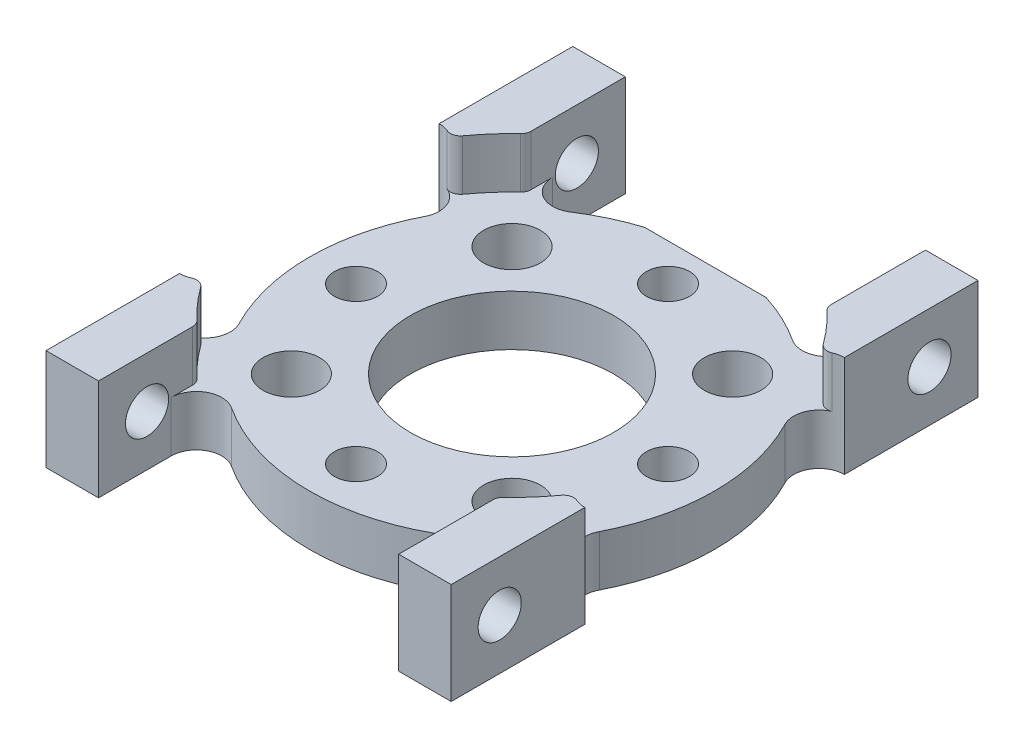
from build123d import *

# Parameters (mm, degrees)
CUT_EXTRUDE1_START         = -6.35
CUT_EXTRUDE1_DEPTH         = 3.175
CUT_EXTRUDE1_START_2       = -3.175
CUT_EXTRUDE1_2_DEPTH       = 3.175
SKETCH2_W                  = 3.293618
SKETCH2_H                  = 6.35
BOSS_EXTRUDE1_DEPTH        = 4.551833731
SKETCH3_W                  = 3.293618
SKETCH3_H                  = 6.35
BOSS_EXTRUDE2_DEPTH        = 4.551833731
SKETCH4_W                  = 3.293618
SKETCH4_H                  = 6.35
BOSS_EXTRUDE3_DEPTH        = 4.551833731
SKETCH5_W                  = 3.293618
SKETCH5_H                  = 6.35
BOSS_EXTRUDE4_DEPTH        = 4.551833731
HOLE1_D                    = 12.7254
M2_5_CLEARANCE_HOLE1_D     = 2.7051
M3_CLEARANCE_HOLE1_D       = 3.556
M2_5_CLEARANCE_HOLE2_D     = 2.7051
M2_5_CLEARANCE_HOLE2_DEPTH = 3.293618
M2_5_CLEARANCE_HOLE3_D     = 2.7051
M2_5_CLEARANCE_HOLE3_DEPTH = 3.293618
M2_5_CLEARANCE_HOLE4_D     = 2.7051
M2_5_CLEARANCE_HOLE4_DEPTH = 25.4
M2_5_CLEARANCE_HOLE5_D     = 2.7051
M2_5_CLEARANCE_HOLE5_DEPTH = 3.293618
FILLET1_R                  = 0.635


with BuildPart() as part:
    # Cut-Extrude1: read off the stored shape, not the designer's step
    # Cut-Extrude1 outline → Cut-Extrude1 (new body)
    with BuildSketch(Plane(origin=(0, 6.35, 0), x_dir=(-1, 0, 0), z_dir=(0, 1, 0)).offset(CUT_EXTRUDE1_START)):
        with BuildLine():
            ThreePointArc((-12.7, 8.135112), (-11.343887812, 7.373541875), (-11.288347253, 5.819210969))
            ThreePointArc((-11.288347253, 5.819210969), (-12.7, 0), (-11.288347253, -5.819210969))
            ThreePointArc((-11.288347253, -5.819210969), (-11.343887812, -7.373541875), (-12.7, -8.135112))
            Line((-12.7, -8.135112), (-12.7, -11.958166269))
            Line((-12.7, -11.958166269), (-9.406382, -11.958166269))
            ThreePointArc((-9.406382, -11.958166269), (-8.574193969, -10.561863981), (-6.950117333, -10.629481128))
            ThreePointArc((-6.950117333, -10.629481128), (0, -12.7), (6.950117333, -10.629481128))
            ThreePointArc((6.950117333, -10.629481128), (8.574193969, -10.561863981), (9.406382, -11.958166269))
            Line((9.406382, -11.958166269), (12.7, -11.958166269))
            Line((12.7, -11.958166269), (12.7, -8.135112))
            ThreePointArc((12.7, -8.135112), (11.343887812, -7.373541875), (11.288347253, -5.819210969))
            ThreePointArc((11.288347253, -5.819210969), (12.7, 0), (11.288347253, 5.819210969))
            ThreePointArc((11.288347253, 5.819210969), (11.343887812, 7.373541875), (12.7, 8.135112))
            Line((12.7, 8.135112), (12.7, 11.958166269))
            Line((12.7, 11.958166269), (9.406382, 11.958166269))
            ThreePointArc((9.406382, 11.958166269), (8.574193969, 10.561863981), (6.950117333, 10.629481128))
            ThreePointArc((6.950117333, 10.629481128), (0, 12.7), (-6.950117333, 10.629481128))
            ThreePointArc((-6.950117333, 10.629481128), (-8.574193969, 10.561863981), (-9.406382, 11.958166269))
            Line((-9.406382, 11.958166269), (-12.7, 11.958166269))
            Line((-12.7, 11.958166269), (-12.7, 8.135112))
        make_face()
    extrude(amount=CUT_EXTRUDE1_DEPTH)

    # Cut-Extrude1 2 outline → Cut-Extrude1 2 (add)
    with BuildSketch(Plane(origin=(0, 6.35, 0), x_dir=(-1, 0, 0), z_dir=(0, 1, 0)).offset(CUT_EXTRUDE1_START_2)):
        with BuildLine():
            Line((-9.406382, 10.328643554), (-9.406382, 11.958166269))
            Line((-9.406382, 11.958166269), (-12.7, 11.958166269))
            Line((-12.7, 11.958166269), (-12.7, 8.135112))
            ThreePointArc((-12.7, 8.135112), (-12.131266538, 8.02978706), (-11.637967358, 7.727782073))
            ThreePointArc((-11.637967358, 7.727782073), (-10.602229958, 9.096901665), (-9.406382, 10.328643554))
        make_face()
        with BuildLine():
            Line((12.7, 11.958166269), (9.406382, 11.958166269))
            Line((9.406382, 11.958166269), (9.406382, 10.328643554))
            ThreePointArc((9.406382, 10.328643554), (10.602229958, 9.096901665), (11.637967358, 7.727782073))
            ThreePointArc((11.637967358, 7.727782073), (12.131266538, 8.02978706), (12.7, 8.135112))
            Line((12.7, 8.135112), (12.7, 11.958166269))
        make_face()
        with BuildLine():
            ThreePointArc((-9.406382, -10.328643554), (-10.602229958, -9.096901665), (-11.637967358, -7.727782073))
            ThreePointArc((-11.637967358, -7.727782073), (-12.131266538, -8.02978706), (-12.7, -8.135112))
            Line((-12.7, -8.135112), (-12.7, -11.958166269))
            Line((-12.7, -11.958166269), (-9.406382, -11.958166269))
            Line((-9.406382, -11.958166269), (-9.406382, -10.328643554))
        make_face()
        with BuildLine():
            ThreePointArc((12.7, -8.135112), (12.131266538, -8.02978706), (11.637967358, -7.727782073))
            ThreePointArc((11.637967358, -7.727782073), (10.602229958, -9.096901665), (9.406382, -10.328643554))
            Line((9.406382, -10.328643554), (9.406382, -11.958166269))
            Line((9.406382, -11.958166269), (12.7, -11.958166269))
            Line((12.7, -11.958166269), (12.7, -8.135112))
        make_face()
    extrude(amount=CUT_EXTRUDE1_2_DEPTH)

    # Sketch2 → Boss-Extrude1 (add)
    with BuildSketch(Plane(origin=(0, 0, -11.958166269), x_dir=(-1, 0, 0), z_dir=(0, 0, -1))):
        with Locations((11.053191, 3.175)):
            Rectangle(SKETCH2_W, SKETCH2_H)
    extrude(amount=BOSS_EXTRUDE1_DEPTH)

    # Sketch3 → Boss-Extrude2 (add)
    with BuildSketch(Plane(origin=(0, 0, -11.958166269), x_dir=(-1, 0, 0), z_dir=(0, 0, -1))):
        with Locations((-11.053191, 3.175)):
            Rectangle(SKETCH3_W, SKETCH3_H)
    extrude(amount=BOSS_EXTRUDE2_DEPTH)

    # Sketch4 → Boss-Extrude3 (add)
    with BuildSketch(Plane.XY.offset(11.958166269)):
        with Locations((11.053191, 3.175)):
            Rectangle(SKETCH4_W, SKETCH4_H)
    extrude(amount=BOSS_EXTRUDE3_DEPTH)

    # Sketch5 → Boss-Extrude4 (add)
    with BuildSketch(Plane.XY.offset(11.958166269)):
        with Locations((-11.053191, 3.175)):
            Rectangle(SKETCH5_W, SKETCH5_H)
    extrude(amount=BOSS_EXTRUDE4_DEPTH)

    # Hole1 (through all)
    with Locations(Plane(origin=(0, 3.175, 0), x_dir=(1, 0, 0), z_dir=(0, 1, 0))):
        with Locations((0, 0)):
            Hole(HOLE1_D / 2)

    # M2.5 Clearance Hole1 (through all)
    with Locations(Plane(origin=(0, 3.175, 0), x_dir=(1, 0, 0), z_dir=(0, 1, 0))):
        with Locations((0, -9.779), (-9.779, 0), (0, 9.779), (9.779, 0)):
            Hole(M2_5_CLEARANCE_HOLE1_D / 2)

    # M3 Clearance Hole1 (through all)
    with Locations(Plane(origin=(0, 3.175, 0), x_dir=(1, 0, 0), z_dir=(0, 1, 0))):
        with Locations((-6.914797213, -6.914797213), (-6.914797213, 6.914797213), (6.914797213, 6.914797213), (6.914797213, -6.914797213)):
            Hole(M3_CLEARANCE_HOLE1_D / 2)

    # M2.5 Clearance Hole2
    with Locations(Plane.ZY.offset(12.7)):
        with Locations((13.470384182, 3.175)):
            Hole(M2_5_CLEARANCE_HOLE2_D / 2, depth=M2_5_CLEARANCE_HOLE2_DEPTH)

    # M2.5 Clearance Hole3
    with Locations(Plane(origin=(-9.406382, 0, 0), x_dir=(0, 0, -1), z_dir=(1, 0, 0))):
        with Locations((13.470384182, 3.175)):
            Hole(M2_5_CLEARANCE_HOLE3_D / 2, depth=M2_5_CLEARANCE_HOLE3_DEPTH)

    # M2.5 Clearance Hole4
    with Locations(Plane(origin=(12.7, 0, 0), x_dir=(0, 0, -1), z_dir=(1, 0, 0))):
        with Locations((13.470384182, 3.175)):
            Hole(M2_5_CLEARANCE_HOLE4_D / 2, depth=M2_5_CLEARANCE_HOLE4_DEPTH)

    # M2.5 Clearance Hole5
    with Locations(Plane.ZY.offset(-9.406382)):
        with Locations((13.470384182, 3.175)):
            Hole(M2_5_CLEARANCE_HOLE5_D / 2, depth=M2_5_CLEARANCE_HOLE5_DEPTH)

    # Fillet1
    # the kernel refuses this fillet: 0.635 mm, written as the material it takes off along each edge
    with BuildSketch(Plane(origin=(-9.406382, 3.175, 10.328643554), x_dir=(0, 0, 1), z_dir=(0, 1, 0)), Plane(origin=(9.406382, 3.175, -10.328643554), x_dir=(0, 0, -1), z_dir=(0, 1, 0))) as fillet1_piece_1:
        with BuildLine():
            CenterArc((0.276858439, -0.635), FILLET1_R, 90, 46.565062077)
            ThreePointArc((-0.184250343, -0.198418174), (-0.091644431, -0.0996555), (0, 0))
            Line((0, 0), (0.276858439, 0))
        make_face()
    extrude(amount=3.867146097, mode=Mode.SUBTRACT)
    with BuildSketch(Plane(origin=(-11.637967358, 3.175, -7.727782073), x_dir=(0.5706588735868443, 0, -0.8211872198205438), z_dir=(0, 1, 0)), Plane(origin=(11.637967358, 3.175, 7.727782073), x_dir=(-0.5706588735868443, 0, 0.8211872198205438), z_dir=(0, 1, 0))) as fillet1_piece_2:
        with BuildLine():
            CenterArc((0.604132084, 0.634858067), FILLET1_R, 191.325534433, 77.463029076)
            ThreePointArc((-0.018502711, 0.51015477), (0.011380109, 0.255825664), (0, 0))
            ThreePointArc((0, 0), (0.295353463, 0.003122527), (0.590706926, 0))
        make_face()
    extrude(amount=4.651767316, mode=Mode.SUBTRACT)
    with BuildSketch(Plane(origin=(-9.406382, 3.175, -10.328643554), x_dir=(0, 0, -1), z_dir=(0, 1, 0)), Plane(origin=(9.406382, 3.175, 10.328643554), x_dir=(0, 0, 1), z_dir=(0, 1, 0))) as fillet1_piece_3:
        with BuildLine():
            CenterArc((0.276858439, 0.635), FILLET1_R, 223.434937923, 46.565062077)
            ThreePointArc((-0.184250343, 0.198418174), (-0.091644431, 0.0996555), (0, 0))
            Line((0, 0), (0.276858439, 0))
        make_face()
    extrude(amount=3.867146097, mode=Mode.SUBTRACT)
    with BuildSketch(Plane(origin=(-11.637967358, 3.175, 7.727782073), x_dir=(0.5706588735868457, 0, 0.8211872198205425), z_dir=(0, 1, 0)), Plane(origin=(11.637967358, 3.175, -7.727782073), x_dir=(-0.5706588735868457, 0, -0.8211872198205425), z_dir=(0, 1, 0))) as fillet1_piece_4:
        with BuildLine():
            CenterArc((0.604132084, -0.634858067), FILLET1_R, 91.211436491, 77.463029076)
            ThreePointArc((-0.018502711, -0.51015477), (0.011380109, -0.255825664), (0, 0))
            ThreePointArc((0, 0), (0.295353463, -0.003122527), (0.590706926, 0))
        make_face()
    extrude(amount=4.651767316, mode=Mode.SUBTRACT)


solid = part.part
